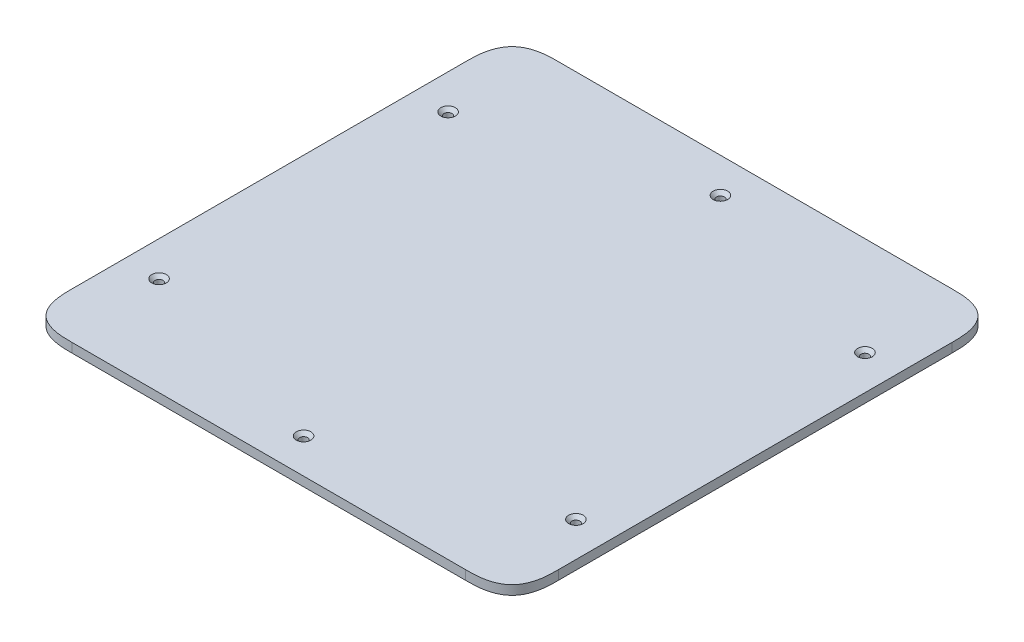
from build123d import *

# Parameters (mm, degrees)
EXTRUDE_1_DEPTH             = 4
HOLE_WIZARD_M32_D           = 3.4
HOLE_WIZARD_M32_CSINK_D     = 6.3
HOLE_WIZARD_M32_CSINK_ANGLE = 90


with BuildPart() as part:
    # Эскиз1 → Бобышка-Вытянуть1 (new body)
    with BuildSketch(Plane(origin=(0, 0, 0), x_dir=(1, 0, 0), z_dir=(0, 1, 0))):
        with BuildLine():
            Line((105, -85), (105, 85))
            add(Edge.make_bspline(
                [(105, 85), (105, 86.369045792), (104.987324741, 87.079340582), (104.967212505, 88.206387976), (104.906039071, 89.152584722), (104.761226492, 91.39246541), (104.344744121, 93.263644052), (103.315574629, 97.887513169), (100.621349625, 100.591827179), (97.92113895, 103.302149274), (93.2884849, 104.339199227), (91.417719264, 104.757982368), (89.176835463, 104.90446255), (88.225090112, 104.966675429), (87.089224134, 104.987147489), (86.37611905, 105), (85, 105)],
                knots=[0, 0, 0, 0.0625, 0.0625, 0.125, 0.125, 0.25, 0.25, 0.5, 0.5, 0.75, 0.75, 0.875, 0.875, 0.9375, 0.9375, 1, 1, 1], degree=2))
            Line((85, 105), (-85, 105))
            add(Edge.make_bspline(
                [(-85, 105), (-86.369045792, 105), (-87.079340582, 104.987324741), (-88.206387976, 104.967212505), (-89.152584722, 104.906039071), (-91.39246541, 104.761226492), (-93.263644052, 104.344744121), (-97.88751317, 103.315574629), (-100.591827179, 100.621349625), (-103.302149274, 97.92113895), (-104.339199227, 93.2884849), (-104.757982368, 91.417719265), (-104.90446255, 89.176835463), (-104.966675429, 88.225090111), (-104.987147489, 87.089224134), (-105, 86.376119049), (-105, 85)],
                knots=[0, 0, 0, 0.0625, 0.0625, 0.125, 0.125, 0.25, 0.25, 0.5, 0.5, 0.75, 0.75, 0.875, 0.875, 0.9375, 0.9375, 1, 1, 1], degree=2))
            Line((-105, 85), (-105, -85))
            add(Edge.make_bspline(
                [(-105, -85), (-105, -86.369045791), (-104.987324741, -87.079340582), (-104.967212505, -88.206387976), (-104.906039071, -89.152584722), (-104.761226492, -91.39246541), (-104.344744121, -93.263644052), (-103.315574629, -97.88751317), (-100.621349625, -100.591827179), (-97.92113895, -103.302149274), (-93.2884849, -104.339199227), (-91.417719264, -104.757982368), (-89.176835463, -104.90446255), (-88.225090111, -104.966675429), (-87.089224134, -104.987147489), (-86.37611905, -105), (-85, -105)],
                knots=[0, 0, 0, 0.0625, 0.0625, 0.125, 0.125, 0.25, 0.25, 0.5, 0.5, 0.75, 0.75, 0.875, 0.875, 0.9375, 0.9375, 1, 1, 1], degree=2))
            Line((-85, -105), (85, -105))
            add(Edge.make_bspline(
                [(85, -105), (86.369045792, -105), (87.079340582, -104.987324741), (88.206387976, -104.967212505), (89.152584722, -104.906039071), (91.39246541, -104.761226492), (93.263644052, -104.344744121), (97.887513169, -103.315574629), (100.591827179, -100.621349625), (103.302149273, -97.92113895), (104.339199227, -93.2884849), (104.757982368, -91.417719265), (104.90446255, -89.176835463), (104.966675429, -88.225090112), (104.987147489, -87.089224134), (105, -86.376119051), (105, -85)],
                knots=[0, 0, 0, 0.0625, 0.0625, 0.125, 0.125, 0.25, 0.25, 0.5, 0.5, 0.75, 0.75, 0.875, 0.875, 0.9375, 0.9375, 1, 1, 1], degree=2))
        make_face()
    extrude(amount=EXTRUDE_1_DEPTH)

    # Зенковка для винта с полупотайной головкой M32 (through all)
    with Locations(Plane(origin=(0, 4, 0), x_dir=(1, 0, 0), z_dir=(0, 1, 0))):
        with Locations((90, -62.4), (90, 62.4), (0, -90), (-90, -62.4), (0, 90), (-90, 62.4)):
            CounterSinkHole(HOLE_WIZARD_M32_D / 2, HOLE_WIZARD_M32_CSINK_D / 2, counter_sink_angle=HOLE_WIZARD_M32_CSINK_ANGLE)


solid = part.part
